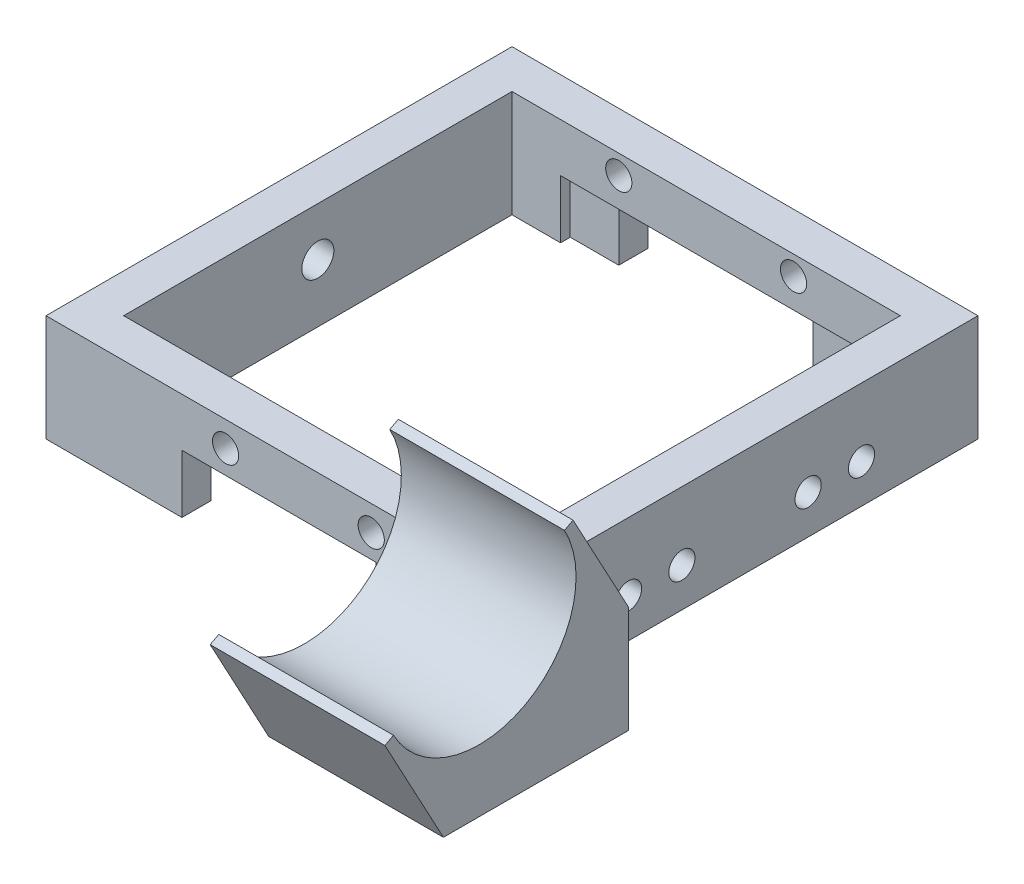
from build123d import *

# Parameters (mm, degrees)
SKETCH1_W                = 48
SKETCH1_H                = 48
SKETCH1_W_2              = 40
SKETCH1_H_2              = 40
BOSS_EXTRUDE1_DEPTH      = 11
SKETCH3_W                = 20
SKETCH3_H                = 6
CUT_EXTRUDE1_DEPTH       = 55.781383699
SKETCH4_W                = 5
SKETCH4_H                = 6
CUT_EXTRUDE2_DEPTH       = 1
SKETCH5_W                = 5
SKETCH5_H                = 6
CUT_EXTRUDE3_DEPTH       = 1
CUT_EXTRUDE4_REACH       = 56.781
SKETCH6_R                = 1.35
CUT_EXTRUDE5_REACH       = 56.781
SKETCH7_R                = 1.35
CUT_EXTRUDE6_REACH       = 56.781
SKETCH8_R                = 1.35
CUT_EXTRUDE7_REACH       = 56.781
SKETCH9_R                = 1.65
BOSS_EXTRUDE7_DEPTH      = 8
BOSS_EXTRUDE7_DEPTH_BACK = 10


with BuildPart() as part:
    # Sketch1 → Boss-Extrude1 (new body)
    with BuildSketch(Plane(origin=(0, 0, 0), x_dir=(1, 0, 0), z_dir=(0, 1, 0))):
        Rectangle(SKETCH1_W, SKETCH1_H)
        Rectangle(SKETCH1_W_2, SKETCH1_H_2, mode=Mode.SUBTRACT)
    extrude(amount=BOSS_EXTRUDE1_DEPTH)

    # Sketch3 → Cut-Extrude1 (cut, through all)
    with BuildSketch(Plane.XY.offset(24)):
        with Locations((0, 3)):
            Rectangle(SKETCH3_W, SKETCH3_H)
    extrude(amount=-CUT_EXTRUDE1_DEPTH, mode=Mode.SUBTRACT)

    # Sketch4 → Cut-Extrude2 (cut)
    with BuildSketch(Plane.XY.offset(-20)):
        with Locations((-12.5, 3)):
            Rectangle(SKETCH4_W, SKETCH4_H)
        with Locations((12.5, 3)):
            Rectangle(SKETCH4_W, SKETCH4_H)
    extrude(amount=-CUT_EXTRUDE2_DEPTH, mode=Mode.SUBTRACT)

    # Sketch5 → Cut-Extrude3 (cut)
    with BuildSketch(Plane(origin=(0, 0, 20), x_dir=(-1, 0, 0), z_dir=(0, 0, -1))):
        with Locations((-12.5, 3)):
            Rectangle(SKETCH5_W, SKETCH5_H)
        with Locations((12.5, 3)):
            Rectangle(SKETCH5_W, SKETCH5_H)
    extrude(amount=-CUT_EXTRUDE3_DEPTH, mode=Mode.SUBTRACT)

    # Sketch6 → Cut-Extrude4 (cut, up to next)
    with BuildSketch(Plane(origin=(0, 0, -24), x_dir=(-1, 0, 0), z_dir=(0, 0, -1)), mode=Mode.PRIVATE) as cut_extrude4_sk1:
        with Locations((-9, 9)):
            Circle(SKETCH6_R)
    cut_extrude4_tool1 = extrude(cut_extrude4_sk1.sketch, amount=-CUT_EXTRUDE4_REACH, mode=Mode.PRIVATE) & part.part
    # Sketch6 → Cut-Extrude4 (cut, up to next)
    with BuildSketch(Plane(origin=(0, 0, -24), x_dir=(-1, 0, 0), z_dir=(0, 0, -1)), mode=Mode.PRIVATE) as cut_extrude4_sk2:
        with Locations((9, 9)):
            Circle(SKETCH6_R)
    cut_extrude4_tool2 = extrude(cut_extrude4_sk2.sketch, amount=-CUT_EXTRUDE4_REACH, mode=Mode.PRIVATE) & part.part
    add(cut_extrude4_tool1.solids().sort_by_distance((9, 9, -24))[0], mode=Mode.SUBTRACT)
    add(cut_extrude4_tool2.solids().sort_by_distance((-9, 9, -24))[0], mode=Mode.SUBTRACT)

    # Sketch7 → Cut-Extrude5 (cut, up to next)
    with BuildSketch(Plane.XY.offset(24), mode=Mode.PRIVATE) as cut_extrude5_sk1:
        with Locations((9.5, 8.412816521)):
            Circle(SKETCH7_R)
    cut_extrude5_tool1 = extrude(cut_extrude5_sk1.sketch, amount=-CUT_EXTRUDE5_REACH, mode=Mode.PRIVATE) & part.part
    # Sketch7 → Cut-Extrude5 (cut, up to next)
    with BuildSketch(Plane.XY.offset(24), mode=Mode.PRIVATE) as cut_extrude5_sk2:
        with Locations((-5.5, 8.412816521)):
            Circle(SKETCH7_R)
    cut_extrude5_tool2 = extrude(cut_extrude5_sk2.sketch, amount=-CUT_EXTRUDE5_REACH, mode=Mode.PRIVATE) & part.part
    add(cut_extrude5_tool1.solids().sort_by_distance((9.5, 8.412817, 24))[0], mode=Mode.SUBTRACT)
    add(cut_extrude5_tool2.solids().sort_by_distance((-5.5, 8.412817, 24))[0], mode=Mode.SUBTRACT)

    # Sketch8 → Cut-Extrude6 (cut, up to next)
    with BuildSketch(Plane(origin=(24, 0, 0), x_dir=(0, 0, -1), z_dir=(1, 0, 0)), mode=Mode.PRIVATE) as cut_extrude6_sk1:
        with Locations((-12, 4)):
            Circle(SKETCH8_R)
    cut_extrude6_tool1 = extrude(cut_extrude6_sk1.sketch, amount=-CUT_EXTRUDE6_REACH, mode=Mode.PRIVATE) & part.part
    # Sketch8 → Cut-Extrude6 (cut, up to next)
    with BuildSketch(Plane(origin=(24, 0, 0), x_dir=(0, 0, -1), z_dir=(1, 0, 0)), mode=Mode.PRIVATE) as cut_extrude6_sk2:
        with Locations((-6.5, 4)):
            Circle(SKETCH8_R)
    cut_extrude6_tool2 = extrude(cut_extrude6_sk2.sketch, amount=-CUT_EXTRUDE6_REACH, mode=Mode.PRIVATE) & part.part
    # Sketch8 → Cut-Extrude6 (cut, up to next)
    with BuildSketch(Plane(origin=(24, 0, 0), x_dir=(0, 0, -1), z_dir=(1, 0, 0)), mode=Mode.PRIVATE) as cut_extrude6_sk3:
        with Locations((6.5, 4)):
            Circle(SKETCH8_R)
    cut_extrude6_tool3 = extrude(cut_extrude6_sk3.sketch, amount=-CUT_EXTRUDE6_REACH, mode=Mode.PRIVATE) & part.part
    # Sketch8 → Cut-Extrude6 (cut, up to next)
    with BuildSketch(Plane(origin=(24, 0, 0), x_dir=(0, 0, -1), z_dir=(1, 0, 0)), mode=Mode.PRIVATE) as cut_extrude6_sk4:
        with Locations((12, 4)):
            Circle(SKETCH8_R)
    cut_extrude6_tool4 = extrude(cut_extrude6_sk4.sketch, amount=-CUT_EXTRUDE6_REACH, mode=Mode.PRIVATE) & part.part
    add(cut_extrude6_tool1.solids().sort_by_distance((24, 4, 12))[0], mode=Mode.SUBTRACT)
    add(cut_extrude6_tool2.solids().sort_by_distance((24, 4, 6.5))[0], mode=Mode.SUBTRACT)
    add(cut_extrude6_tool3.solids().sort_by_distance((24, 4, -6.5))[0], mode=Mode.SUBTRACT)
    add(cut_extrude6_tool4.solids().sort_by_distance((24, 4, -12))[0], mode=Mode.SUBTRACT)

    # Sketch9 → Cut-Extrude7 (cut, up to next)
    with BuildSketch(Plane.ZY.offset(24), mode=Mode.PRIVATE) as cut_extrude7_sk1:
        with Locations((0, 6)):
            Circle(SKETCH9_R)
    cut_extrude7_tool1 = extrude(cut_extrude7_sk1.sketch, amount=-CUT_EXTRUDE7_REACH, mode=Mode.PRIVATE) & part.part
    add(cut_extrude7_tool1.solids().sort_by_distance((-24, 6, 0))[0], mode=Mode.SUBTRACT)

    # Sketch10 → Boss-Extrude7 (add, two sides: drawn at the far end of the back side and taken through both)
    with BuildSketch(Plane(origin=(24, 0, 0), x_dir=(0, 0, -1), z_dir=(1, 0, 0)).offset(-BOSS_EXTRUDE7_DEPTH_BACK)):
        with BuildLine():
            Line((-20, 0), (-20, 11))
            Line((-20, 11), (-25.711810571, 21.622325672))
            Line((-25.711810571, 21.622325672), (-26.592555065, 21.148733931))
            ThreePointArc((-26.592555065, 21.148733931), (-30.66408259, 7.605371586), (-44.207444935, 11.676899111))
            Line((-44.207444935, 11.676899111), (-45.088189429, 11.20330737))
            Line((-45.088189429, 11.20330737), (-39.063974822, 0))
            Line((-39.063974822, 0), (-20, 0))
        make_face()
    extrude(amount=BOSS_EXTRUDE7_DEPTH + BOSS_EXTRUDE7_DEPTH_BACK)


solid = part.part
